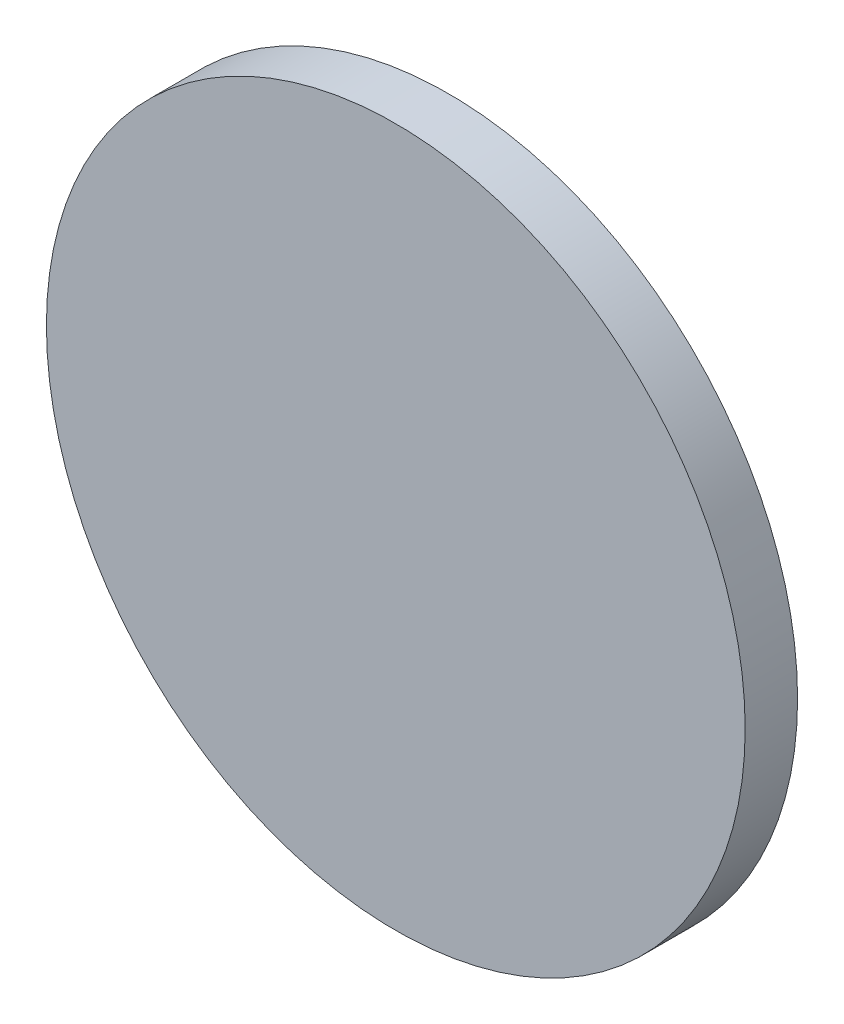
from build123d import *

# Parameters (mm, degrees)
ESQUISSE1_R        = 40
BOSS_EXTRU_1_DEPTH = 6


with BuildPart() as part:
    # Esquisse1 → Boss.-Extru.1 (new body)
    with BuildSketch(Plane.XY):
        Circle(ESQUISSE1_R)
    extrude(amount=BOSS_EXTRU_1_DEPTH)


solid = part.part
